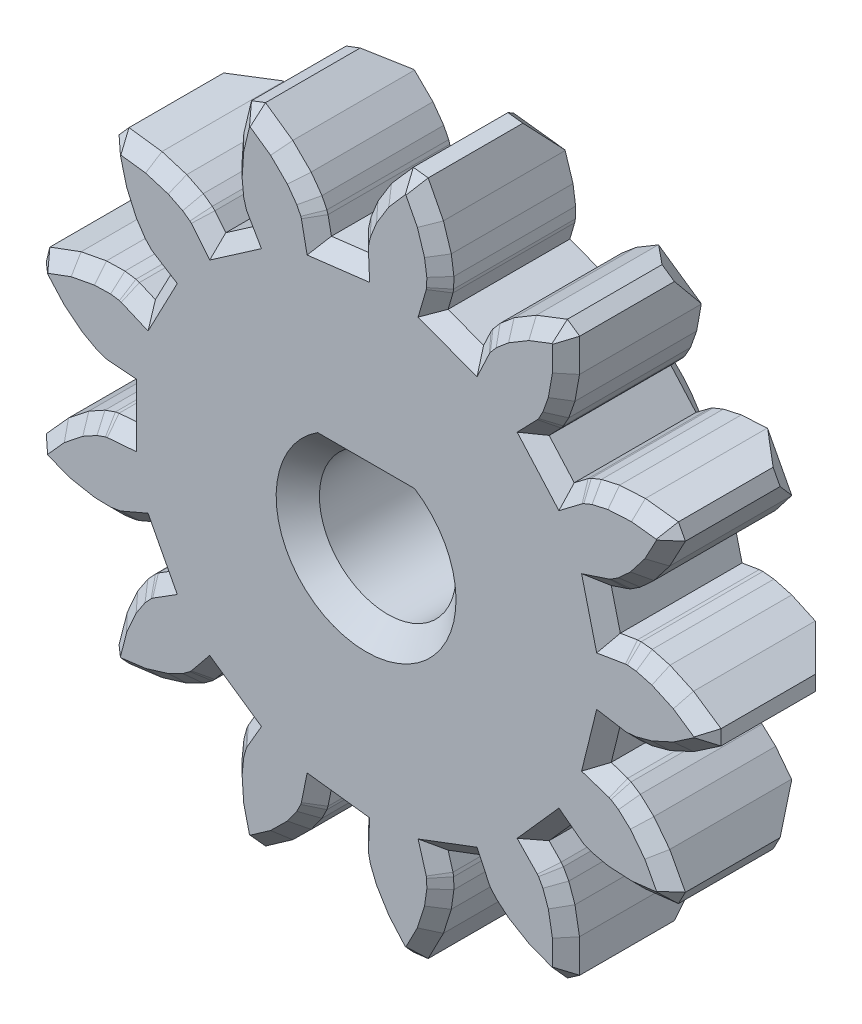
from build123d import *

# Parameters (mm, degrees)
BOSS_EXTRUDE1_DEPTH = 5
SKETCH1_R           = 8
BOSS_EXTRUDE2_DEPTH = 3
CUT_EXTRUDE1_DEPTH  = 7.1
CHAMFER5_SIZE       = 1
CHAMFER6_SIZE       = 0.5
CUT_EXTRUDE2_START  = -0.9
SKETCH3_R           = 2.525
CUT_EXTRUDE2_DEPTH  = 0.9
CHAMFER8_SIZE       = 3
CHAMFER9_SIZE       = 0.5
CHAMFER9_SIZE2      = 0.866025404
CHAMFER10_SIZE      = 0.8


with BuildPart() as part:
    # Model → Boss-Extrude1 (new body)
    with BuildSketch(Plane.XY):
        Polygon((-12.322, -2.752), (-11.499, -1.837), (-10.75, -1.243), (-10.152, -0.913), (-9.766, -0.777), (-9.632, -0.751), (-8.992, -0.701), (-8.992, 0.701), (-9.632, 0.751), (-9.766, 0.777), (-10.152, 0.913), (-10.75, 1.243), (-11.499, 1.837), (-12.322, 2.752), (-12.189, 3.29), (-11.036, 3.717), (-10.096, 3.895), (-9.414, 3.91), (-9.008, 3.851), (-8.878, 3.811), (-8.288, 3.558), (-7.637, 4.8), (-8.18, 5.141), (-8.286, 5.226), (-8.565, 5.527), (-8.941, 6.096), (-9.328, 6.971), (-9.631, 8.163), (-9.264, 8.577), (-8.045, 8.42), (-7.129, 8.141), (-6.519, 7.837), (-6.187, 7.596), (-6.09, 7.501), (-5.685, 7.002), (-4.532, 7.799), (-4.854, 8.354), (-4.908, 8.478), (-5.016, 8.874), (-5.084, 9.553), (-5.02, 10.508), (-4.735, 11.704), (-4.217, 11.9), (-3.21, 11.194), (-2.529, 10.522), (-2.13, 9.968), (-1.948, 9.601), (-1.907, 9.471), (-1.78, 8.842), (-0.388, 9.011), (-0.416, 9.652), (-0.406, 9.788), (-0.317, 10.189), (-0.062, 10.821), (0.438, 11.637), (1.246, 12.563), (1.796, 12.497), (2.36, 11.404), (2.65, 10.492), (2.746, 9.817), (2.737, 9.407), (2.713, 9.273), (2.533, 8.657), (3.845, 8.16), (4.118, 8.74), (4.189, 8.856), (4.454, 9.169), (4.974, 9.611), (5.796, 10.101), (6.942, 10.545), (7.398, 10.23), (7.389, 9.001), (7.222, 8.059), (6.994, 7.416), (6.795, 7.057), (6.712, 6.949), (6.266, 6.487), (7.196, 5.438), (7.708, 5.825), (7.825, 5.895), (8.205, 6.049), (8.871, 6.198), (9.826, 6.25), (11.047, 6.111), (11.305, 5.62), (10.726, 4.536), (10.14, 3.779), (9.639, 3.316), (9.296, 3.091), (9.173, 3.034), (8.563, 2.832), (8.899, 1.471), (9.532, 1.576), (9.668, 1.583), (10.076, 1.543), (10.735, 1.366), (11.605, 0.968), (12.622, 0.277), (12.622, -0.277), (11.605, -0.968), (10.735, -1.366), (10.076, -1.543), (9.668, -1.583), (9.532, -1.576), (8.899, -1.471), (8.563, -2.832), (9.173, -3.034), (9.296, -3.091), (9.639, -3.316), (10.14, -3.779), (10.726, -4.536), (11.305, -5.62), (11.047, -6.111), (9.826, -6.25), (8.871, -6.198), (8.205, -6.049), (7.825, -5.895), (7.708, -5.825), (7.196, -5.438), (6.266, -6.487), (6.712, -6.949), (6.795, -7.057), (6.994, -7.416), (7.222, -8.059), (7.389, -9.001), (7.398, -10.23), (6.942, -10.545), (5.796, -10.101), (4.974, -9.611), (4.454, -9.169), (4.189, -8.856), (4.118, -8.74), (3.845, -8.16), (2.533, -8.657), (2.713, -9.273), (2.737, -9.407), (2.746, -9.817), (2.65, -10.492), (2.36, -11.404), (1.796, -12.497), (1.246, -12.563), (0.438, -11.637), (-0.062, -10.821), (-0.317, -10.189), (-0.406, -9.788), (-0.416, -9.652), (-0.388, -9.011), (-1.78, -8.842), (-1.907, -9.471), (-1.948, -9.601), (-2.13, -9.968), (-2.529, -10.522), (-3.21, -11.194), (-4.217, -11.9), (-4.735, -11.704), (-5.02, -10.508), (-5.084, -9.553), (-5.016, -8.874), (-4.908, -8.478), (-4.854, -8.354), (-4.532, -7.799), (-5.685, -7.002), (-6.09, -7.501), (-6.187, -7.596), (-6.519, -7.837), (-7.129, -8.141), (-8.045, -8.42), (-9.264, -8.577), (-9.631, -8.163), (-9.328, -6.971), (-8.941, -6.096), (-8.565, -5.527), (-8.286, -5.226), (-8.18, -5.141), (-7.637, -4.8), (-8.288, -3.558), (-8.878, -3.811), (-9.008, -3.851), (-9.414, -3.91), (-10.096, -3.895), (-11.036, -3.717), (-12.189, -3.29), align=None)
    extrude(amount=BOSS_EXTRUDE1_DEPTH)

    # Sketch1 → Boss-Extrude2 (add)
    with BuildSketch(Plane(origin=(0, 0, 0), x_dir=(-1, 0, 0), z_dir=(0, 0, -1))):
        with Locations(Location((0, 0, 0), (0, 0, 180))):
            Circle(SKETCH1_R)
    extrude(amount=BOSS_EXTRUDE2_DEPTH)

    # Sketch2 → Cut-Extrude1 (cut)
    with BuildSketch(Plane.XY.offset(5)):
        with BuildLine():
            Line((-1.541306264, 2), (1.541306264, 2))
            ThreePointArc((1.541306264, 2), (0, -2.525), (-1.541306264, 2))
        make_face()
    extrude(amount=-CUT_EXTRUDE1_DEPTH, mode=Mode.SUBTRACT)

    # Chamfer5
    chamfer5_edges = [part.edges().sort_by_distance(p)[0] for p in [
        (-12.2555, 3.021, 0),
        (-9.4475, 8.37, 0),
        (-4.476, 11.802, 0),
        (1.521, 12.53, 0),
        (7.17, 10.3875, 0),
        (11.176, 5.8655, 0),
        (12.622, 0, 0),
        (11.176, -5.8655, 0),
        (7.17, -10.3875, 0),
        (1.521, -12.53, 0),
        (-4.476, -11.802, 0),
        (-9.4475, -8.37, 0),
        (-12.2555, -3.021, 0),
    ]]
    chamfer(chamfer5_edges, length=CHAMFER5_SIZE)

    # Chamfer6
    chamfer6_edges = [part.edges().sort_by_distance(p)[0] for p in [
        (-10.566, -3.806, 5),
        (-2.039, -9.7845, 5),
        (-1.9275, -9.536, 5),
        (-1.8435, -9.1565, 5),
        (-1.084, -8.9265, 5),
        (-0.402, -9.3315, 5),
        (-0.411, -9.72, 5),
        (-0.3615, -9.9885, 5),
        (-0.1895, -10.505, 5),
        (0.188, -11.229, 5),
        (0.842, -12.1, 5),
        (-9.755, -3.9025, 5),
        (1.521, -12.53, 5),
        (2.078, -11.9505, 5),
        (2.505, -10.948, 5),
        (2.698, -10.1545, 5),
        (2.7415, -9.612, 5),
        (2.725, -9.34, 5),
        (2.623, -8.965, 5),
        (3.189, -8.4085, 5),
        (3.9815, -8.45, 5),
        (4.1535, -8.798, 5),
        (-9.211, -3.8805, 5),
        (4.3215, -9.0125, 5),
        (4.714, -9.39, 5),
        (5.385, -9.856, 5),
        (6.369, -10.323, 5),
        (7.17, -10.3875, 5),
        (7.3935, -9.6155, 5),
        (7.3055, -8.53, 5),
        (7.108, -7.7375, 5),
        (6.8945, -7.2365, 5),
        (6.7535, -7.003, 5),
        (-8.943, -3.831, 5),
        (6.489, -6.718, 5),
        (6.731, -5.9625, 5),
        (7.452, -5.6315, 5),
        (7.7665, -5.86, 5),
        (8.015, -5.972, 5),
        (8.538, -6.1235, 5),
        (9.3485, -6.224, 5),
        (10.4365, -6.1805, 5),
        (11.176, -5.8655, 5),
        (11.0155, -5.078, 5),
        (-8.583, -3.6845, 5),
        (10.433, -4.1575, 5),
        (9.8895, -3.5475, 5),
        (9.4675, -3.2035, 5),
        (9.2345, -3.0625, 5),
        (8.868, -2.933, 5),
        (8.731, -2.1515, 5),
        (9.2155, -1.5235, 5),
        (9.6, -1.5795, 5),
        (9.872, -1.563, 5),
        (10.4055, -1.4545, 5),
        (-7.9625, -4.179, 5),
        (11.17, -1.167, 5),
        (12.1135, -0.6225, 5),
        (12.622, 0, 5),
        (12.1135, 0.6225, 5),
        (11.17, 1.167, 5),
        (10.4055, 1.4545, 5),
        (9.872, 1.563, 5),
        (9.6, 1.5795, 5),
        (9.2155, 1.5235, 5),
        (8.731, 2.1515, 5),
        (-7.9085, -4.9705, 5),
        (8.868, 2.933, 5),
        (9.2345, 3.0625, 5),
        (9.4675, 3.2035, 5),
        (9.8895, 3.5475, 5),
        (10.433, 4.1575, 5),
        (11.0155, 5.078, 5),
        (11.176, 5.8655, 5),
        (10.4365, 6.1805, 5),
        (9.3485, 6.224, 5),
        (8.538, 6.1235, 5),
        (-8.233, -5.1835, 5),
        (8.015, 5.972, 5),
        (7.7665, 5.86, 5),
        (7.452, 5.6315, 5),
        (6.731, 5.9625, 5),
        (6.489, 6.718, 5),
        (6.7535, 7.003, 5),
        (6.8945, 7.2365, 5),
        (7.108, 7.7375, 5),
        (7.3055, 8.53, 5),
        (7.3935, 9.6155, 5),
        (-8.4255, -5.3765, 5),
        (7.17, 10.3875, 5),
        (6.369, 10.323, 5),
        (5.385, 9.856, 5),
        (4.714, 9.39, 5),
        (4.3215, 9.0125, 5),
        (4.1535, 8.798, 5),
        (3.9815, 8.45, 5),
        (3.189, 8.4085, 5),
        (2.623, 8.965, 5),
        (2.725, 9.34, 5),
        (-8.753, -5.8115, 5),
        (2.7415, 9.612, 5),
        (2.698, 10.1545, 5),
        (2.505, 10.948, 5),
        (2.078, 11.9505, 5),
        (1.521, 12.53, 5),
        (0.842, 12.1, 5),
        (0.188, 11.229, 5),
        (-0.1895, 10.505, 5),
        (-0.3615, 9.9885, 5),
        (-0.411, 9.72, 5),
        (-12.2555, -3.021, 5),
        (-9.1345, -6.5335, 5),
        (-0.402, 9.3315, 5),
        (-1.084, 8.9265, 5),
        (-1.8435, 9.1565, 5),
        (-1.9275, 9.536, 5),
        (-2.039, 9.7845, 5),
        (-2.3295, 10.245, 5),
        (-2.8695, 10.858, 5),
        (-3.7135, 11.547, 5),
        (-4.476, 11.802, 5),
        (-4.8775, 11.106, 5),
        (-9.4795, -7.567, 5),
        (-5.052, 10.0305, 5),
        (-5.05, 9.2135, 5),
        (-4.962, 8.676, 5),
        (-4.881, 8.416, 5),
        (-4.693, 8.0765, 5),
        (-5.1085, 7.4005, 5),
        (-5.8875, 7.2515, 5),
        (-6.1385, 7.5485, 5),
        (-6.353, 7.7165, 5),
        (-6.824, 7.989, 5),
        (-9.4475, -8.37, 5),
        (-7.587, 8.2805, 5),
        (-8.6545, 8.4985, 5),
        (-9.4475, 8.37, 5),
        (-9.4795, 7.567, 5),
        (-9.1345, 6.5335, 5),
        (-8.753, 5.8115, 5),
        (-8.4255, 5.3765, 5),
        (-8.233, 5.1835, 5),
        (-7.9085, 4.9705, 5),
        (-7.9625, 4.179, 5),
        (-8.6545, -8.4985, 5),
        (-8.583, 3.6845, 5),
        (-8.943, 3.831, 5),
        (-9.211, 3.8805, 5),
        (-9.755, 3.9025, 5),
        (-10.566, 3.806, 5),
        (-11.6125, 3.5035, 5),
        (-12.2555, 3.021, 5),
        (-11.9105, 2.2945, 5),
        (-11.1245, 1.54, 5),
        (-10.451, 1.078, 5),
        (-7.587, -8.2805, 5),
        (-9.959, 0.845, 5),
        (-9.699, 0.764, 5),
        (-9.312, 0.726, 5),
        (-8.992, 0, 5),
        (-9.312, -0.726, 5),
        (-9.699, -0.764, 5),
        (-9.959, -0.845, 5),
        (-10.451, -1.078, 5),
        (-11.1245, -1.54, 5),
        (-11.9105, -2.2945, 5),
        (-6.824, -7.989, 5),
        (-6.353, -7.7165, 5),
        (-6.1385, -7.5485, 5),
        (-5.8875, -7.2515, 5),
        (-5.1085, -7.4005, 5),
        (-11.6125, -3.5035, 5),
        (-4.693, -8.0765, 5),
        (-4.881, -8.416, 5),
        (-4.962, -8.676, 5),
        (-5.05, -9.2135, 5),
        (-5.052, -10.0305, 5),
        (-4.8775, -11.106, 5),
        (-4.476, -11.802, 5),
        (-3.7135, -11.547, 5),
        (-2.8695, -10.858, 5),
        (-2.3295, -10.245, 5),
    ]]
    chamfer(chamfer6_edges, length=CHAMFER6_SIZE)

    # Sketch3 → Cut-Extrude2 (cut)
    with BuildSketch(Plane(origin=(0, 0, -3), x_dir=(-1, 0, 0), z_dir=(0, 0, -1)).offset(CUT_EXTRUDE2_START)):
        with Locations(Location((0, 0, 0), (0, 0, 127.619756551))):
            Circle(SKETCH3_R)
    extrude(amount=CUT_EXTRUDE2_DEPTH, mode=Mode.SUBTRACT)

    # Chamfer8
    chamfer8_edges = [part.edges().sort_by_distance(p)[0] for p in [
        (-8, 0, -3),
    ]]
    chamfer(chamfer8_edges, length=CHAMFER8_SIZE - 0.0001)  # a hair under: the kernel refuses the full size

    # Chamfer9
    chamfer9_edges = [part.edges().sort_by_distance(p)[0] for p in [
        (-1.541306264, -2, -3),
    ]]
    chamfer9_side = [part.faces().sort_by_distance(p)[0] for p in [
        (-4.858675815, 0, -3),
    ]]
    chamfer(chamfer9_edges, length=CHAMFER9_SIZE, length2=CHAMFER9_SIZE2, reference=chamfer9_side[0])

    # Chamfer10
    chamfer10_edges = [part.edges().sort_by_distance(p)[0] for p in [
        (0, -2.525, 5),
        (0, 2, 5),
    ]]
    chamfer(chamfer10_edges, length=CHAMFER10_SIZE)


solid = part.part
